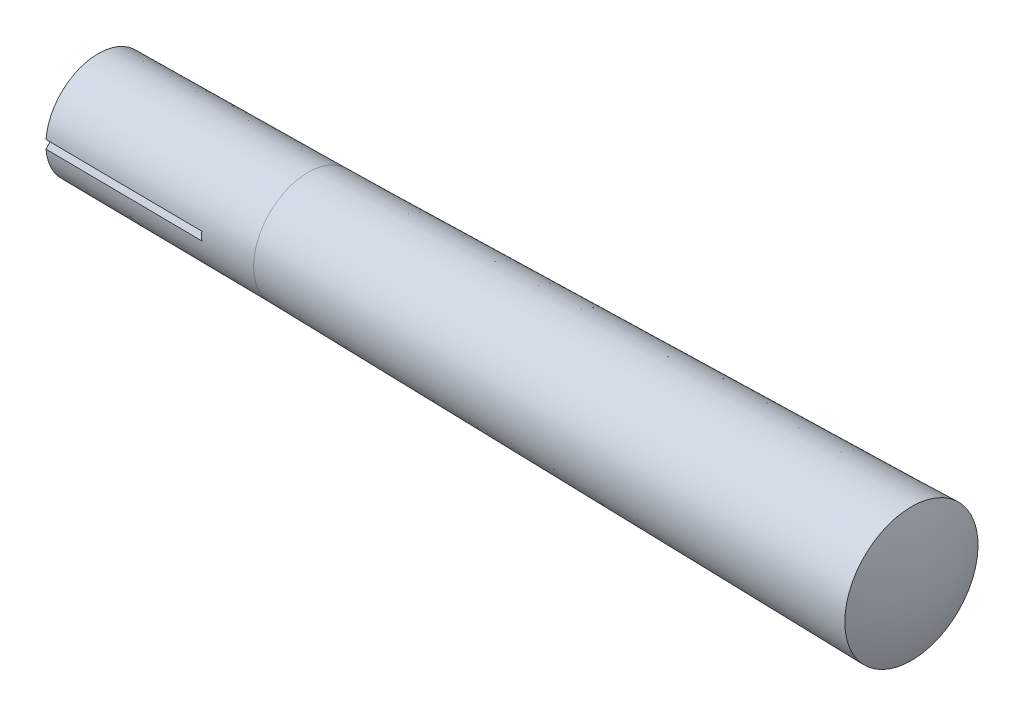
from build123d import *

# Parameters (mm, degrees)
SPLIT_2_DEPTH      = 30
SPLIT_2_DEPTH_BACK = 159.520787785
SPLSKE_W           = 25.4004
SPLSKE_H           = 1.6


with BuildPart() as part:
    # BodySke → BaseBody (revolve)
    with BuildSketch(Plane.XY):
        with BuildLine():
            Line((0, 10), (40, 10.4))
            Line((40, 10.4), (155.01, 12.7002))
            ThreePointArc((155.01, 12.7002), (156.87163014, 6.470996446), (157.5, 0))
            Line((157.5, 0), (-2.5, 0))
            ThreePointArc((-2.5, 0), (-1.905301144, 5.163825286), (0, 10))
        make_face()
    revolve(axis=Axis((0, 0, 0), (1, 0, 0)))

    # SplSke → Split 2 (cut, two sides: drawn at the far end of the back side and taken through both)
    with BuildSketch(Plane(origin=(0, 0, 0), x_dir=(0, 0, -1), z_dir=(1, 0, 0)).offset(-SPLIT_2_DEPTH_BACK)):
        Rectangle(SPLSKE_W, SPLSKE_H)
    extrude(amount=SPLIT_2_DEPTH + SPLIT_2_DEPTH_BACK, mode=Mode.SUBTRACT)


solid = part.part
